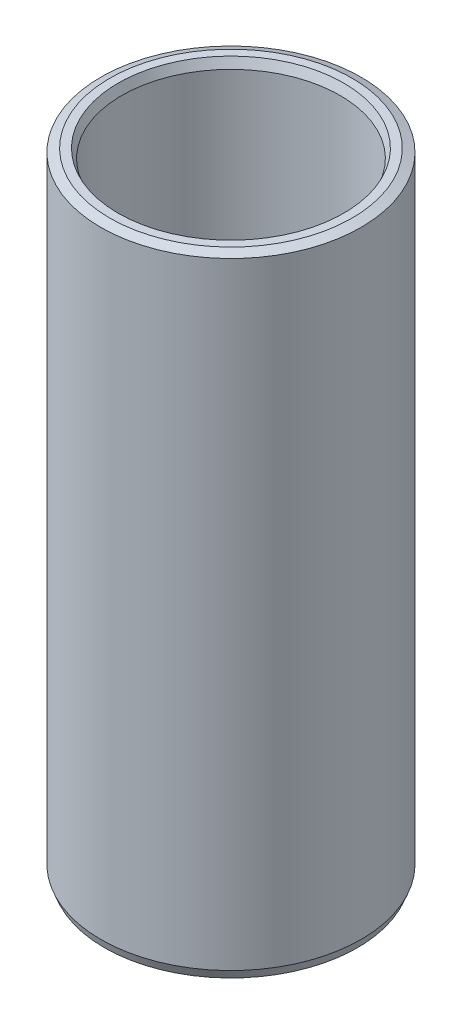
from build123d import *
from OCP.BRepFilletAPI import BRepFilletAPI_MakeChamfer

# Parameters (mm, degrees)
SKETCH1_R           = 55
BOSS_EXTRUDE1_DEPTH = 265.875630394
SKETCH2_R           = 46.15080246
CUT_EXTRUDE1_DEPTH  = 278.019585657
CHAMFER1_SIZE       = 1.507083713
CHAMFER1_SIZE2      = 3.790602088


with BuildPart() as part:
    # Sketch1 → Boss-Extrude1 (new body)
    with BuildSketch(Plane(origin=(0, 0, 0), x_dir=(1, 0, 0), z_dir=(0, 1, 0))):
        Circle(SKETCH1_R)
    extrude(amount=BOSS_EXTRUDE1_DEPTH)

    # Sketch2 → Cut-Extrude1 (cut, through all)
    with BuildSketch(Plane(origin=(0, 0, 0), x_dir=(1, 0, 0), z_dir=(0, 1, 0))):
        Circle(SKETCH2_R)
    extrude(amount=CUT_EXTRUDE1_DEPTH, mode=Mode.SUBTRACT)

    # Chamfer1: one chamfer whose edges measure the first distance from different faces: ONE call of the kernel's chamfer builder (chamfer() names one face for all edges)
    chamfer1_edges_1 = [part.edges().sort_by_distance(p)[0] for p in [
        (-46.15080246, 265.875630394, 0),
    ]]
    chamfer1_side_1 = [part.faces().sort_by_distance(p)[0] for p in [
        (-53.444365081, 265.875630394, 0),
    ]]
    chamfer1_edges_2 = [part.edges().sort_by_distance(p)[0] for p in [
        (-46.15080246, 0, 0),
    ]]
    chamfer1_side_2 = [part.faces().sort_by_distance(p)[0] for p in [
        (-46.15080246, 132.937815197, 0),
    ]]
    chamfer1_edges_3 = [part.edges().sort_by_distance(p)[0] for p in [
        (-55, 0, 0),
    ]]
    chamfer1_side_3 = [part.faces().sort_by_distance(p)[0] for p in [
        (-53.444365081, 0, 0),
    ]]
    chamfer1_edges_4 = [part.edges().sort_by_distance(p)[0] for p in [
        (-55, 265.875630394, 0),
    ]]
    chamfer1_side_4 = [part.faces().sort_by_distance(p)[0] for p in [
        (-55, 132.937815197, 0),
    ]]
    chamfer1 = BRepFilletAPI_MakeChamfer(part.part.solid().wrapped)
    for e in chamfer1_edges_1:
        chamfer1.Add(CHAMFER1_SIZE, CHAMFER1_SIZE2, e.wrapped, chamfer1_side_1[0].wrapped)  # the first distance lies on this face
    for e in chamfer1_edges_2:
        chamfer1.Add(CHAMFER1_SIZE, CHAMFER1_SIZE2, e.wrapped, chamfer1_side_2[0].wrapped)  # the first distance lies on this face
    for e in chamfer1_edges_3:
        chamfer1.Add(CHAMFER1_SIZE, CHAMFER1_SIZE2, e.wrapped, chamfer1_side_3[0].wrapped)  # the first distance lies on this face
    for e in chamfer1_edges_4:
        chamfer1.Add(CHAMFER1_SIZE, CHAMFER1_SIZE2, e.wrapped, chamfer1_side_4[0].wrapped)  # the first distance lies on this face
    add(Compound.cast(chamfer1.Shape()), mode=Mode.REPLACE)


solid = part.part
